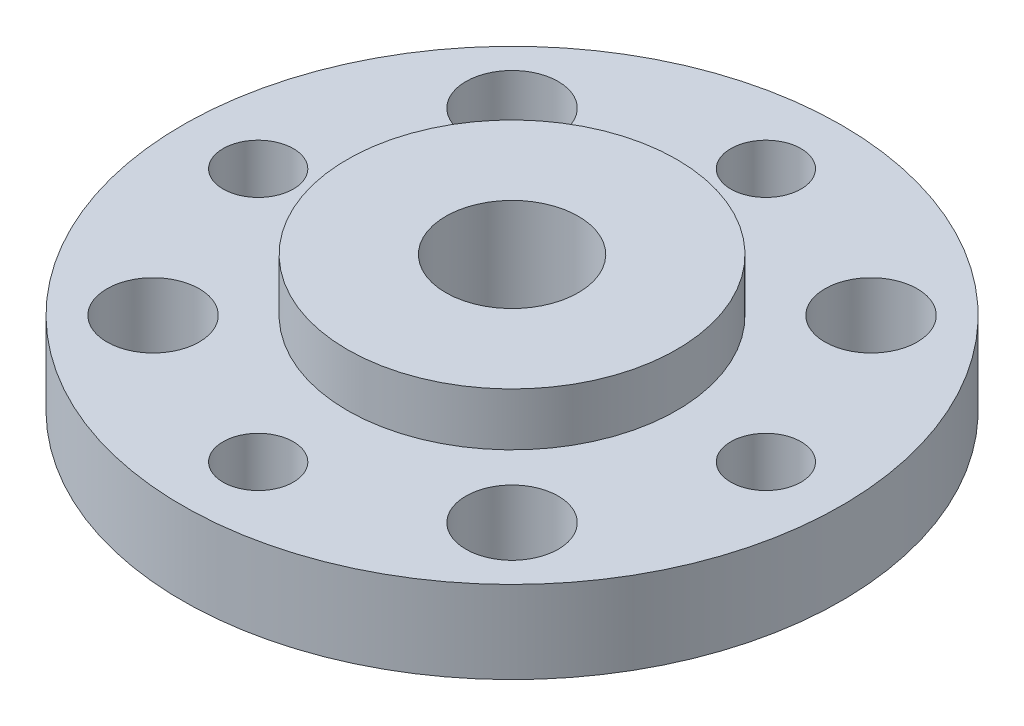
from build123d import *

# Parameters (mm, degrees)
SKETCH1_W                = 12.69619
SKETCH1_H                = 3.175
SKETCH2_R                = 6.34619
BOSS_EXTRUDE1_DEPTH      = 2.032
M2_5_CLEARANCE_HOLE1_D   = 2.7051
HOLE1_D                  = 5.1054
M3_CLEARANCE_HOLE1_D     = 3.556
M3_CLEARANCE_HOLE1_DEPTH = 5.207


with BuildPart() as part:
    # Sketch1 → Revolve1 (revolve)
    with BuildSketch(Plane.XY):
        with Locations((6.348095, 1.5875)):
            Rectangle(SKETCH1_W, SKETCH1_H)
    revolve(axis=Axis((0, 3.175, 0), (0, -1, 0)))

    # Sketch2 → Boss-Extrude1 (add)
    with BuildSketch(Plane(origin=(0, 3.175, 0), x_dir=(-1, 0, 0), z_dir=(0, 1, 0))):
        Circle(SKETCH2_R)
    extrude(amount=BOSS_EXTRUDE1_DEPTH)

    # M2.5 Clearance Hole1 (through all)
    with Locations(Plane(origin=(0, 3.175, 0), x_dir=(1, 0, 0), z_dir=(0, 1, 0))):
        with Locations((-9.779, 0), (0, 9.779), (9.779, 0), (0, -9.779)):
            Hole(M2_5_CLEARANCE_HOLE1_D / 2)

    # Hole1 (through all)
    with Locations(Plane(origin=(0, 5.207, 0), x_dir=(1, 0, 0), z_dir=(0, 1, 0))):
        with Locations((0, 0)):
            Hole(HOLE1_D / 2)

    # M3 Clearance Hole1
    with Locations(Plane(origin=(0, 0, 0), x_dir=(-1, 0, 0), z_dir=(0, -1, 0))):
        with Locations((6.914797213, 6.914797213), (-6.914797213, 6.914797213), (-6.914797213, -6.914797213), (6.914797213, -6.914797213)):
            Hole(M3_CLEARANCE_HOLE1_D / 2, depth=M3_CLEARANCE_HOLE1_DEPTH)


solid = part.part
